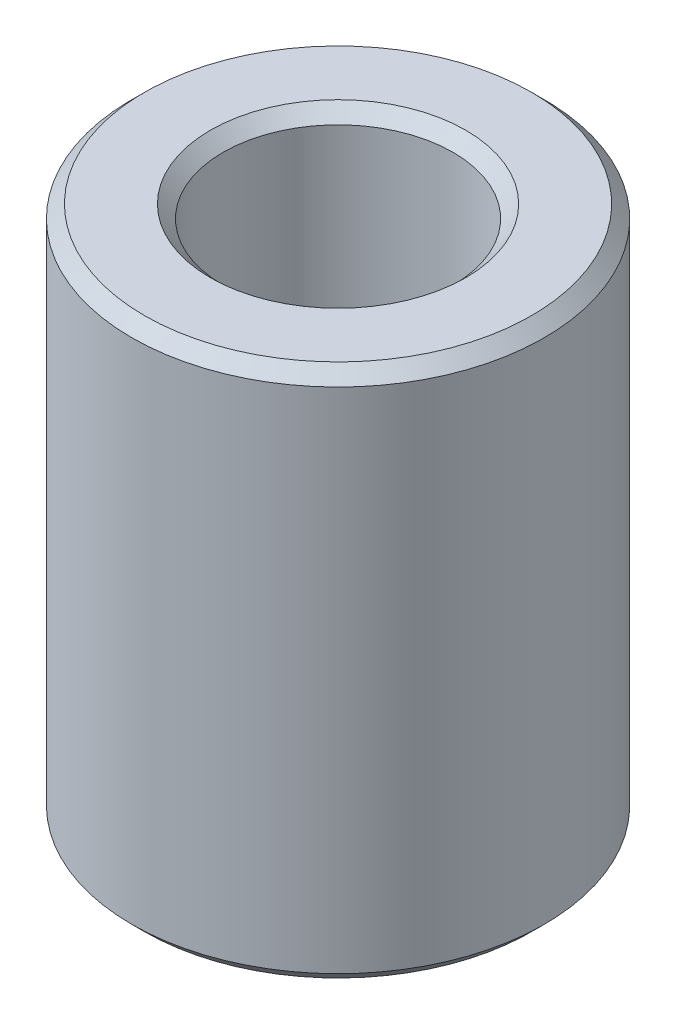
from build123d import *

# Parameters (mm, degrees)
SKETCH1_R           = 52.5
BOSS_EXTRUDE1_DEPTH = 135.81879517
SKETCH2_R           = 29.269778124
CUT_EXTRUDE1_DEPTH  = 155.787742155
CHAMFER1_SIZE       = 3.244651048


with BuildPart() as part:
    # Sketch1 → Boss-Extrude1 (new body)
    with BuildSketch(Plane(origin=(0, 0, 0), x_dir=(1, 0, 0), z_dir=(0, 1, 0))):
        Circle(SKETCH1_R)
    extrude(amount=BOSS_EXTRUDE1_DEPTH)

    # Sketch2 → Cut-Extrude1 (cut, through all)
    with BuildSketch(Plane(origin=(0, 0, 0), x_dir=(1, 0, 0), z_dir=(0, 1, 0))):
        Circle(SKETCH2_R)
    extrude(amount=CUT_EXTRUDE1_DEPTH, mode=Mode.SUBTRACT)

    # Chamfer1
    chamfer1_edges = [part.edges().sort_by_distance(p)[0] for p in [
        (-29.269778124, 135.81879517, 0),
        (-29.269778124, 0, 0),
        (-52.5, 0, 0),
        (-52.5, 135.81879517, 0),
    ]]
    chamfer(chamfer1_edges, length=CHAMFER1_SIZE)


solid = part.part
